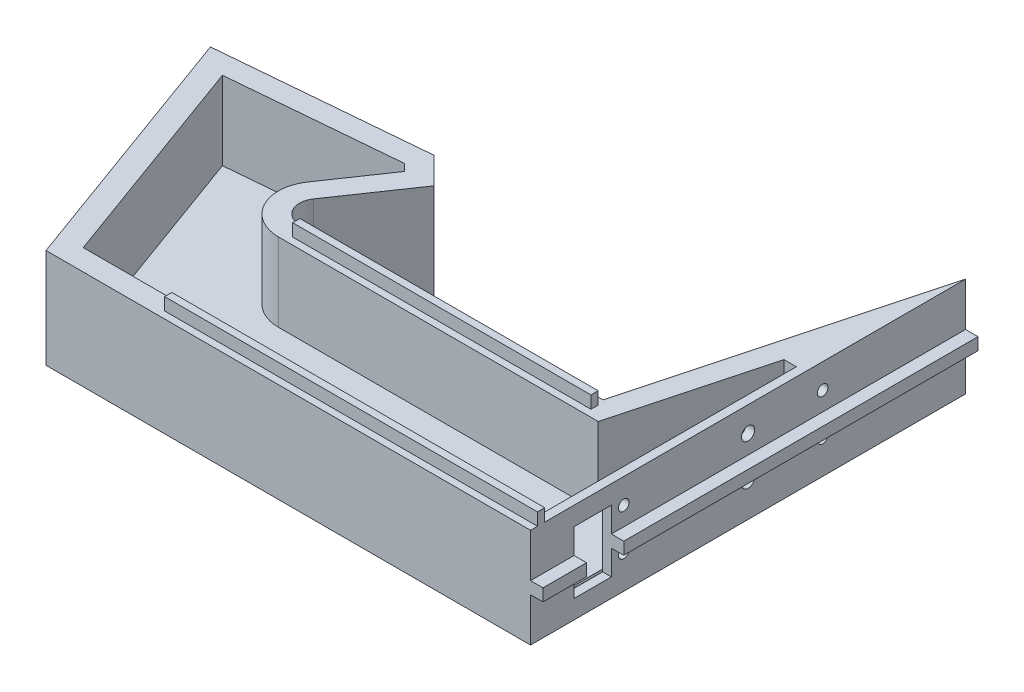
from build123d import *

# Parameters (mm, degrees)
SKETCH1_W               = 240
SKETCH1_H               = 175
BOSS_EXTRUDE1_DEPTH     = 40
CUT_EXTRUDE1_DEPTH      = 173.622771337
CUT_EXTRUDE1_DEPTH_BACK = 40
SKETCH3_W               = 5
SKETCH3_H               = 4.9
BOSS_EXTRUDE2_DEPTH     = 175
SHELL1_START            = 8.5
SHELL1_DEPTH            = 31.5
SKETCH4_R               = 2.65
SKETCH4_R_2             = 2.15
CUT_EXTRUDE2_DEPTH      = 8.5
CUT_EXTRUDE3_START      = -31.5
SKETCH5_W               = 5
SKETCH5_H               = 101.936090041
CUT_EXTRUDE3_DEPTH      = 31.5
SKETCH6_W               = 150
SKETCH6_H               = 2.9
SKETCH6_W_2             = 120
BOSS_EXTRUDE3_DEPTH     = 5
CUT_EXTRUDE4_REACH      = 277.406
SKETCH8_W               = 15
SKETCH8_H               = 25
BOSS_EXTRUDE4_DEPTH     = 10
CUT_EXTRUDE5_START      = -50
CUT_EXTRUDE5_DEPTH      = 50
BOSS_EXTRUDE5_DEPTH     = 31.5


# Read off the part's stored shape, not the designer's step: Shell1
with BuildPart() as part:
    # Sketch1 → Boss-Extrude1 (new body)
    with BuildSketch(Plane(origin=(0, 0, 0), x_dir=(1, 0, 0), z_dir=(0, 1, 0))):
        with Locations((0, 29.967532468)):
            Rectangle(SKETCH1_W, SKETCH1_H)
    extrude(amount=BOSS_EXTRUDE1_DEPTH)

    # Sketch2 → Cut-Extrude1 (cut, two sides: drawn at the far end of the back side and taken through both)
    with BuildSketch(Plane(origin=(0, 40, 0), x_dir=(1, 0, 0), z_dir=(0, 1, 0)).offset(-CUT_EXTRUDE1_DEPTH_BACK)):
        with BuildLine():
            Line((724.053869611, -57.532467532), (120, -57.532467532))
            Line((120, -57.532467532), (-82.377784234, -57.532467532))
            Line((-82.377784234, -57.532467532), (-120, 45.833720754))
            Line((-120, 45.833720754), (-30, 53.707700471))
            Line((-30, 53.707700471), (-19.393398282, 43.101098754))
            Line((-19.393398282, 43.101098754), (-39.130306901, 14.196870029))
            ThreePointArc((-39.130306901, 14.196870029), (-39.568663615, 6.465392529), (-32.936543603, 2.467532468))
            Line((-32.936543603, 2.467532468), (89.18584287, 2.467532468))
            Line((89.18584287, 2.467532468), (120, 117.467532468))
            Line((120, 117.467532468), (276.340645723, 700.938765595))
            Line((276.340645723, 700.938765595), (-764.036200619, 86.821246577))
            Line((-764.036200619, 86.821246577), (-316.322976731, -671.64998655))
            Line((-316.322976731, -671.64998655), (724.053869611, -57.532467532))
        make_face()
    extrude(amount=CUT_EXTRUDE1_DEPTH + CUT_EXTRUDE1_DEPTH_BACK, mode=Mode.SUBTRACT)

    # Sketch3 → Boss-Extrude2 (add)
    with BuildSketch(Plane.XY.offset(57.532467532)):
        with Locations((122.5, 20)):
            Rectangle(SKETCH3_W, SKETCH3_H)
    extrude(amount=-BOSS_EXTRUDE2_DEPTH)

    # Shell1 outline → Shell1 (cut)
    with BuildSketch(Plane(origin=(0, 0, 0), x_dir=(1, 0, 0), z_dir=(0, 1, 0)).offset(SHELL1_START)):
        with BuildLine():
            Line((111.5, -49.032467532), (111.5, 52.903622509))
            Line((111.5, 52.903622509), (95.708122268, -6.032467532))
            Line((95.708122268, -6.032467532), (-32.936543603, -6.032467532))
            ThreePointArc((-32.936543603, -6.032467532), (-47.085066295, 2.4963006), (-46.149905305, 18.990119265))
            Line((-46.149905305, 18.990119265), (-30.387255785, 42.074140976))
            Line((-30.387255785, 42.074140976), (-33.207708529, 44.89459372))
            Line((-33.207708529, 44.89459372), (-108.223913428, 38.331526211))
            Line((-108.223913428, 38.331526211), (-76.426020159, -49.032467532))
            Line((-76.426020159, -49.032467532), (111.5, -49.032467532))
        make_face()
    extrude(amount=SHELL1_DEPTH, mode=Mode.SUBTRACT)

    # Sketch4 → Cut-Extrude2 (cut)
    with BuildSketch(Plane(origin=(120, 0, 0), x_dir=(0, 0, -1), z_dir=(1, 0, 0))):
        with Locations((29.967532468, 30)):
            Circle(SKETCH4_R)
        with Locations((59.967532468, 30)):
            Circle(SKETCH4_R_2)
        with Locations((-20.032467532, 30)):
            Circle(SKETCH4_R_2)
        with Locations((29.967532468, 13.5)):
            Circle(SKETCH4_R)
        with Locations((59.967532468, 13.5)):
            Circle(SKETCH4_R_2)
        with Locations((-20.032467532, 13.5)):
            Circle(SKETCH4_R_2)
    extrude(amount=-CUT_EXTRUDE2_DEPTH, mode=Mode.SUBTRACT)

    # Sketch5 → Cut-Extrude3 (cut)
    with BuildSketch(Plane(origin=(0, 40, 0), x_dir=(1, 0, 0), z_dir=(0, 1, 0)).offset(CUT_EXTRUDE3_START)):
        with Locations((114, 1.935577488)):
            Rectangle(SKETCH5_W, SKETCH5_H)
    extrude(amount=CUT_EXTRUDE3_DEPTH, mode=Mode.SUBTRACT)

    # Sketch6 → Boss-Extrude3 (add)
    with BuildSketch(Plane(origin=(0, 40, 0), x_dir=(1, 0, 0), z_dir=(0, 1, 0))):
        with Locations((45, -53.282467532)):
            Rectangle(SKETCH6_W, SKETCH6_H)
        with Locations((30, -1.782467532)):
            Rectangle(SKETCH6_W_2, SKETCH6_H)
    extrude(amount=BOSS_EXTRUDE3_DEPTH)

    # Cut-Extrude4: up to this face of the body (flat: up to its plane)
    cut_extrude4_end = Plane(part.part.faces().sort_by_distance((116.5, 24.308295021, -1.744734026))[0])
    # Sketch8 → Cut-Extrude4 (cut, up to the picked face)
    with BuildSketch(Plane(origin=(125, 0, 0), x_dir=(0, 0, -1), z_dir=(1, 0, 0)), mode=Mode.PRIVATE) as cut_extrude4_sk1:
        with Locations((-32.532467532, 20)):
            Rectangle(SKETCH8_W, SKETCH8_H)
    cut_extrude4_tool1 = split(extrude(cut_extrude4_sk1.sketch, amount=-CUT_EXTRUDE4_REACH, mode=Mode.PRIVATE), bisect_by=cut_extrude4_end, keep=Keep.BOTH, mode=Mode.PRIVATE)
    add(cut_extrude4_tool1.solids().sort_by(Axis((125, 20, 32.532468), (-1, 0, 0)))[0], mode=Mode.SUBTRACT)


with BuildPart() as body_2:
    # Sketch9 → Boss-Extrude4 (new body)
    with BuildSketch(Plane(origin=(0, 40, 0), x_dir=(1, 0, 0), z_dir=(0, 1, 0))):
        with BuildLine():
            Line((120, -57.532467532), (120, 117.467532468))
            Line((120, 117.467532468), (89.18584287, 2.467532468))
            Line((89.18584287, 2.467532468), (-32.936543603, 2.467532468))
            ThreePointArc((-32.936543603, 2.467532468), (-39.568663615, 6.465392529), (-39.130306901, 14.196870029))
            Line((-39.130306901, 14.196870029), (-19.393398282, 43.101098754))
            Line((-19.393398282, 43.101098754), (-30, 53.707700471))
            Line((-30, 53.707700471), (-120, 45.833720754))
            Line((-120, 45.833720754), (-82.377784234, -57.532467532))
            Line((-82.377784234, -57.532467532), (120, -57.532467532))
        make_face()
    extrude(amount=BOSS_EXTRUDE4_DEPTH)


with BuildPart() as cut_extrude5_tool:
    # Sketch10 → Cut-Extrude5 (new body)
    with BuildSketch(Plane(origin=(0, 50, 0), x_dir=(1, 0, 0), z_dir=(0, 1, 0)).offset(CUT_EXTRUDE5_START)):
        Polygon((-120, 45.833720754), (-112.780643506, 46.465332605), (-74.928539827, -57.532467532), (-82.377784234, -57.532467532), align=None)
    extrude(amount=CUT_EXTRUDE5_DEPTH)


with BuildPart() as part_1:
    add(part.part)

    # Cut-Extrude5: cut by cut_extrude5_tool
    add(cut_extrude5_tool.part, mode=Mode.SUBTRACT)

    # Sketch11 → Boss-Extrude5 (add)
    with BuildSketch(Plane(origin=(0, 40, 0), x_dir=(1, 0, 0), z_dir=(0, 1, 0))):
        Polygon((-108.223913428, 38.331526211), (-100.488888614, 39.008253194), (-68.444686866, -49.032467532), (-76.426020159, -49.032467532), align=None)
    extrude(amount=-BOSS_EXTRUDE5_DEPTH)


with BuildPart() as body_2_1:
    add(body_2.part)

    # Cut-Extrude5: cut by cut_extrude5_tool
    add(cut_extrude5_tool.part, mode=Mode.SUBTRACT)


solid = part_1.part
